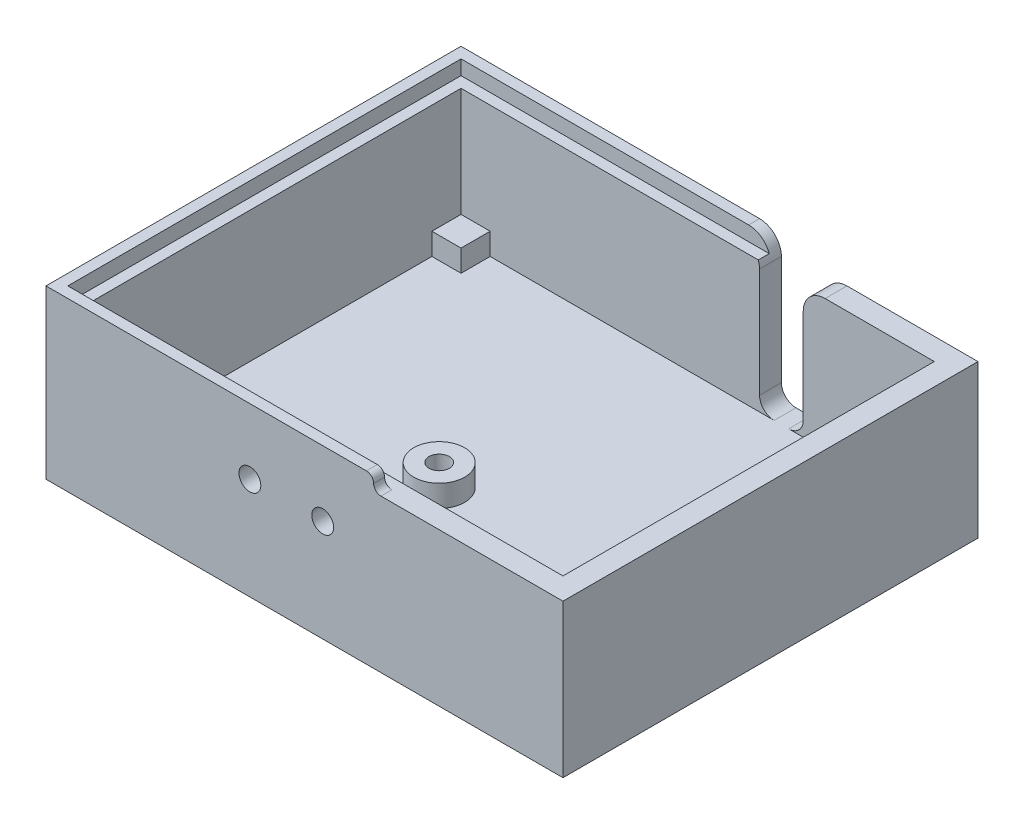
from build123d import *

# Parameters (mm, degrees)
SKETCH1_W           = 71
SKETCH1_H           = 57
BOSS_EXTRUDE1_DEPTH = 3
SKETCH2_W           = 71
SKETCH2_H           = 57
SKETCH2_W_2         = 65
SKETCH2_H_2         = 51
BOSS_EXTRUDE2_DEPTH = 18
SKETCH3_W           = 4
SKETCH3_H           = 4
BOSS_EXTRUDE3_DEPTH = 3
SKETCH4_R           = 3.5
BOSS_EXTRUDE4_DEPTH = 3
CUT_EXTRUDE1_REACH  = 49.932
SKETCH5_R           = 1.4
SKETCH6_W           = 71
SKETCH6_H           = 57
SKETCH6_W_2         = 68
SKETCH6_H_2         = 54
BOSS_EXTRUDE5_DEPTH = 2
SKETCH7_W           = 26
SKETCH7_H           = 2
CUT_EXTRUDE2_DEPTH  = 71.980631161
FILLET1_R           = 1
CUT_EXTRUDE3_REACH  = 72.981
FILLET2_R           = 3
FILLET3_R           = 3
CUT_EXTRUDE4_REACH  = 72.981
SKETCH9_R           = 1.5


with BuildPart() as part:
    # Sketch1 → Boss-Extrude1 (new body)
    with BuildSketch(Plane(origin=(0, 0, 0), x_dir=(1, 0, 0), z_dir=(0, 1, 0))):
        Rectangle(SKETCH1_W, SKETCH1_H)
    extrude(amount=BOSS_EXTRUDE1_DEPTH)

    # Sketch2 → Boss-Extrude2 (add)
    with BuildSketch(Plane(origin=(0, 3, 0), x_dir=(1, 0, 0), z_dir=(0, 1, 0))):
        Rectangle(SKETCH2_W, SKETCH2_H)
        Rectangle(SKETCH2_W_2, SKETCH2_H_2, mode=Mode.SUBTRACT)
    extrude(amount=BOSS_EXTRUDE2_DEPTH)

    # Sketch3 → Boss-Extrude3 (add)
    with BuildSketch(Plane(origin=(0, 3, 0), x_dir=(1, 0, 0), z_dir=(0, 1, 0))):
        with Locations((-30.5, 23.5)):
            Rectangle(SKETCH3_W, SKETCH3_H)
        with Locations((30.5, 23.5)):
            Rectangle(SKETCH3_W, SKETCH3_H)
        with Locations((30.5, -23.5)):
            Rectangle(SKETCH3_W, SKETCH3_H)
        with Locations((-30.5, -23.5)):
            Rectangle(SKETCH3_W, SKETCH3_H)
    extrude(amount=BOSS_EXTRUDE3_DEPTH)

    # Sketch4 → Boss-Extrude4 (add)
    with BuildSketch(Plane(origin=(0, 3, 0), x_dir=(1, 0, 0), z_dir=(0, 1, 0))):
        with Locations(Location((-4.5, -5.5, 0), (0, 0, 270))):
            Circle(SKETCH4_R)
    extrude(amount=BOSS_EXTRUDE4_DEPTH)

    # Sketch5 → Cut-Extrude1 (cut, up to next)
    with BuildSketch(Plane(origin=(0, 6, 0), x_dir=(1, 0, 0), z_dir=(0, 1, 0)), mode=Mode.PRIVATE) as cut_extrude1_sk1:
        with Locations(Location((-4.5, -5.5, 0), (0, 0, 270))):
            Circle(SKETCH5_R)
    cut_extrude1_tool1 = extrude(cut_extrude1_sk1.sketch, amount=-CUT_EXTRUDE1_REACH, mode=Mode.PRIVATE) & part.part
    add(cut_extrude1_tool1.solids().sort_by_distance((-4.5, 6, 5.5))[0], mode=Mode.SUBTRACT)

    # Sketch6 → Boss-Extrude5 (add)
    with BuildSketch(Plane(origin=(0, 21, 0), x_dir=(1, 0, 0), z_dir=(0, 1, 0))):
        Rectangle(SKETCH6_W, SKETCH6_H)
        Rectangle(SKETCH6_W_2, SKETCH6_H_2, mode=Mode.SUBTRACT)
    extrude(amount=BOSS_EXTRUDE5_DEPTH)

    # Sketch7 → Cut-Extrude2 (cut, through all)
    with BuildSketch(Plane.XY.offset(28.5)):
        with Locations((22.5, 22)):
            Rectangle(SKETCH7_W, SKETCH7_H)
    extrude(amount=-CUT_EXTRUDE2_DEPTH, mode=Mode.SUBTRACT)

    # Fillet1
    fillet1_edges = [part.edges().sort_by_distance(p)[0] for p in [
        (9.5, 21, -27.75),
        (9.5, 21, 27.75),
    ]]
    fillet(fillet1_edges, radius=FILLET1_R)
    fillet1_2_edges = [part.edges().sort_by_distance(p)[0] for p in [
        (9.5, 23, -27.75),
        (9.5, 23, 27.75),
    ]]
    fillet(fillet1_2_edges, radius=FILLET1_R - 0.0001)  # a hair under: the kernel refuses the full size

    # Sketch8 → Cut-Extrude3 (cut, up to next)
    with BuildSketch(Plane(origin=(0, 0, -28.5), x_dir=(-1, 0, 0), z_dir=(0, 0, -1)), mode=Mode.PRIVATE) as cut_extrude3_sk1:
        with BuildLine():
            Line((-14.5, 23.871984023), (-8.5, 23.871984023))
            Line((-8.5, 23.871984023), (-8.5, 5))
            ThreePointArc((-8.5, 5), (-9.085786438, 3.585786438), (-10.5, 3))
            Line((-10.5, 3), (-12.5, 3))
            ThreePointArc((-12.5, 3), (-13.914213562, 3.585786438), (-14.5, 5))
            Line((-14.5, 5), (-14.5, 23.871984023))
        make_face()
    cut_extrude3_tool1 = extrude(cut_extrude3_sk1.sketch, amount=-CUT_EXTRUDE3_REACH, mode=Mode.PRIVATE) & part.part
    add(cut_extrude3_tool1.solids().sort_by_distance((11.5, 13.574839, -28.5))[0], mode=Mode.SUBTRACT)

    # Fillet2
    fillet2_edges = [part.edges().sort_by_distance(p)[0] for p in [
        (14.5, 21, -27),
    ]]
    fillet(fillet2_edges, radius=FILLET2_R)

    # Fillet3
    fillet3_edges = [part.edges().sort_by_distance(p)[0] for p in [
        (8.5, 23, -27.75),
    ]]
    fillet(fillet3_edges, radius=FILLET3_R)

    # Sketch9 → Cut-Extrude4 (cut, up to next)
    with BuildSketch(Plane.XY.offset(28.5), mode=Mode.PRIVATE) as cut_extrude4_sk1:
        with Locations((2.5, 14)):
            Circle(SKETCH9_R)
    cut_extrude4_tool1 = extrude(cut_extrude4_sk1.sketch, amount=-CUT_EXTRUDE4_REACH, mode=Mode.PRIVATE) & part.part
    # Sketch9 → Cut-Extrude4 (cut, up to next)
    with BuildSketch(Plane.XY.offset(28.5), mode=Mode.PRIVATE) as cut_extrude4_sk2:
        with Locations((-7.5, 14)):
            Circle(SKETCH9_R)
    cut_extrude4_tool2 = extrude(cut_extrude4_sk2.sketch, amount=-CUT_EXTRUDE4_REACH, mode=Mode.PRIVATE) & part.part
    add(cut_extrude4_tool1.solids().sort_by_distance((2.5, 14, 28.5))[0], mode=Mode.SUBTRACT)
    add(cut_extrude4_tool2.solids().sort_by_distance((-7.5, 14, 28.5))[0], mode=Mode.SUBTRACT)


solid = part.part
